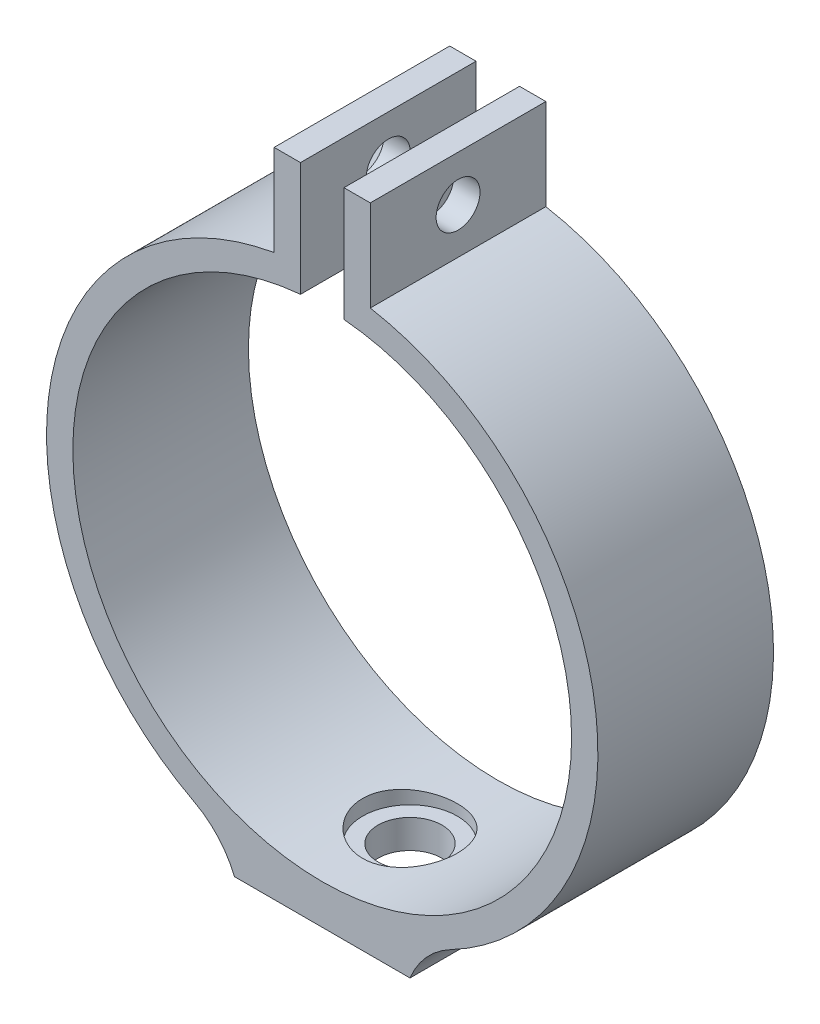
from build123d import *

# Parameters (mm, degrees)
BOSS_EXTRUDE1_DEPTH                 = 20
FILLET1_R                           = 10
SKETCH3_R                           = 5.4
CUT_EXTRUDE3_DEPTH                  = 1.23
CUT_EXTRUDE3_DIRECTION_2_REACH      = 81.023
CUT_EXTRUDE3_DIRECTION_2_END_RADIUS = 28.405
SKETCH4_R                           = 3.64
CUT_EXTRUDE4_DEPTH                  = 81.10998653
SKETCH5_R                           = 2.5
CUT_EXTRUDE5_DEPTH                  = 59.869498141


with BuildPart() as part:
    # Sketch2 → Boss-Extrude1 (new body)
    with BuildSketch(Plane.XY):
        with BuildLine():
            Line((-10, -29.770354801), (-10, -32.905))
            Line((-10, -32.905), (10, -32.905))
            Line((10, -32.905), (10, -29.770354801))
            ThreePointArc((10, -29.770354801), (31.318108327, 2.334548309), (5.475658873, 30.923958105))
            Line((5.475658873, 30.923958105), (5.475658873, 41.296910399))
            Line((5.475658873, 41.296910399), (2.475658873, 41.296910399))
            Line((2.475658873, 41.296910399), (2.475658873, 28.296910399))
            ThreePointArc((2.475658873, 28.296910399), (0, -28.405), (-2.475658873, 28.296910399))
            Line((-2.475658873, 28.296910399), (-2.475658873, 41.296910399))
            Line((-2.475658873, 41.296910399), (-5.475658873, 41.296910399))
            Line((-5.475658873, 41.296910399), (-5.475658873, 30.923958105))
            ThreePointArc((-5.475658873, 30.923958105), (-31.318108327, 2.334548309), (-10, -29.770354801))
        make_face()
    extrude(amount=BOSS_EXTRUDE1_DEPTH)

    # Fillet1
    # the kernel refuses this fillet: 10 mm, written as the material it adds along each edge
    with BuildSketch(Plane(origin=(10, -29.770354801, 0), x_dir=(0, -1, 0), z_dir=(0, 0, 1))) as fillet1_piece_1:
        with BuildLine():
            CenterArc((6.874989117, 9.274148337), FILLET1_R, 207.74277492, 40.292580152)
            Line((-1.975474334, 4.619119153), (-2.152483603, 4.526018569))
            ThreePointArc((-2.152483603, 4.526018569), (-1.079113359, 2.270480411), (-0.189589905, -0.063684127))
            Line((-0.189589905, -0.063684127), (0, -0.2))
            ThreePointArc((0, -0.2), (1.567322599, -0.2), (3.05983832, -0.185482967))
            Line((3.05983832, -0.185482967), (3.134645199, 0))
        make_face()
    extrude(amount=20)
    with BuildSketch(Plane(origin=(-10, -29.770354801, 0), x_dir=(0, -1, 0), z_dir=(0, 0, 1))) as fillet1_piece_2:
        with BuildLine():
            CenterArc((6.874989117, -9.274148337), FILLET1_R, 111.964644928, 40.292580152)
            Line((-1.975474334, -4.619119153), (-2.152483603, -4.526018569))
            ThreePointArc((-2.152483603, -4.526018569), (-1.079113359, -2.270480411), (-0.189589905, 0.063684127))
            Line((-0.189589905, 0.063684127), (0, 0.2))
            ThreePointArc((0, 0.2), (1.567322599, 0.2), (3.05983832, 0.185482967))
            Line((3.05983832, 0.185482967), (3.134645199, 0))
        make_face()
    extrude(amount=20)

    # Sketch3 → Cut-Extrude3 (cut)
    with BuildSketch(Plane(origin=(0, -28.405, 0), x_dir=(1, 0, 0), z_dir=(0, 1, 0))):
        with Locations(Location((0, -10, 0), (0, 0, 90))):
            Circle(SKETCH3_R)
    extrude(amount=-CUT_EXTRUDE3_DEPTH, mode=Mode.SUBTRACT)

    # Cut-Extrude3 direction 2: up to this cylinder (the profile starts outside it)
    cut_extrude3_direction_2_end = Plane(origin=(0, 0, 10), z_dir=(0, 0, -1)) * Cylinder(CUT_EXTRUDE3_DIRECTION_2_END_RADIUS, 219.856, mode=Mode.PRIVATE)
    # Sketch3 → Cut-Extrude3 direction 2 (cut, up to the surface)
    with BuildSketch(Plane(origin=(0, -28.405, 0), x_dir=(1, 0, 0), z_dir=(0, 1, 0)), mode=Mode.PRIVATE) as cut_extrude3_direction_2_sk1:
        with Locations(Location((0, -10, 0), (0, 0, 90))):
            Circle(SKETCH3_R)
    cut_extrude3_direction_2_tool1 = extrude(cut_extrude3_direction_2_sk1.sketch, amount=CUT_EXTRUDE3_DIRECTION_2_REACH, mode=Mode.PRIVATE) - cut_extrude3_direction_2_end
    add(cut_extrude3_direction_2_tool1.solids().sort_by_distance((0, -28.405, 10))[0], mode=Mode.SUBTRACT)
    add(cut_extrude3_direction_2_tool1.solids().sort_by_distance((0, -28.405, 10))[1], mode=Mode.SUBTRACT)

    # Sketch4 → Cut-Extrude4 (cut, through all)
    with BuildSketch(Plane(origin=(0, -29.635, 0), x_dir=(1, 0, 0), z_dir=(0, 1, 0))):
        with Locations(Location((0, -10, 0), (0, 0, 180))):
            Circle(SKETCH4_R)
    extrude(amount=-CUT_EXTRUDE4_DEPTH, mode=Mode.SUBTRACT)

    # Sketch5 → Cut-Extrude5 (cut, through all)
    with BuildSketch(Plane.ZY.offset(5.475658873)):
        with Locations(Location((10, 36.110434252, 0), (0, 0, 270))):
            Circle(SKETCH5_R)
    extrude(amount=-CUT_EXTRUDE5_DEPTH, mode=Mode.SUBTRACT)


solid = part.part
